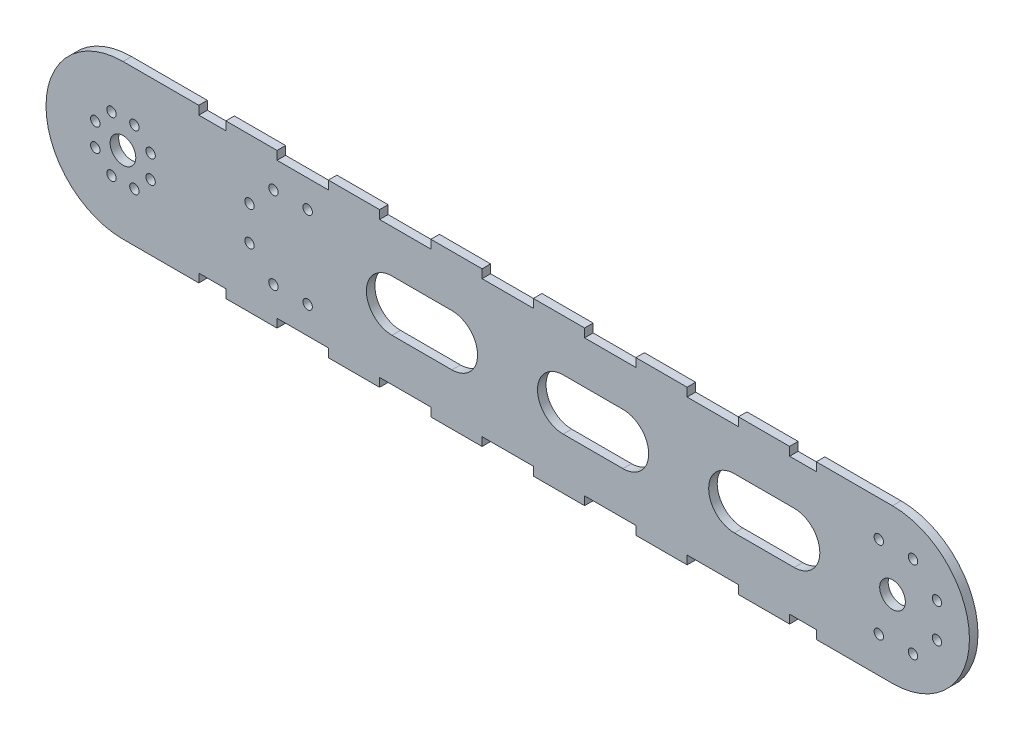
from build123d import *

# Parameters (mm, degrees)
SKETCH3_R           = 2.75
SKETCH3_R_2         = 7.5
BOSS_EXTRUDE1_DEPTH = 5
SKETCH3_3_W         = 15.822872328
SKETCH3_3_H         = 5
SKETCH3_3_W_2       = 30
SKETCH3_3_W_3       = 15.601661999
CUT_EXTRUDE1_DEPTH  = 292.043381646


with BuildPart() as part:
    # Sketch3 → Boss-Extrude1 (new body)
    with BuildSketch(Plane.XY):
        with BuildLine():
            ThreePointArc((-242.5, 45), (-287.5, 0), (-242.5, -45))
            Line((-242.5, -45), (207.5, -45))
            ThreePointArc((207.5, -45), (252.5, 0), (207.5, 45))
            Line((207.5, 45), (-242.5, 45))
        make_face()
        with Locations((-154.5, -24)):
            Circle(SKETCH3_R, mode=Mode.SUBTRACT)
        with Locations((-134.5, -24)):
            Circle(SKETCH3_R, mode=Mode.SUBTRACT)
        with Locations((-249.196960066, -16.167891819)):
            Circle(SKETCH3_R, mode=Mode.SUBTRACT)
        with Locations((-235.803039934, -16.167891819)):
            Circle(SKETCH3_R, mode=Mode.SUBTRACT)
        with Locations((-258.667891819, -6.696960066)):
            Circle(SKETCH3_R, mode=Mode.SUBTRACT)
        with Locations((-226.332108181, -6.696960066)):
            Circle(SKETCH3_R, mode=Mode.SUBTRACT)
        with Locations((-242.5, 0)):
            Circle(SKETCH3_R_2, mode=Mode.SUBTRACT)
        with Locations((-168.5, -10)):
            Circle(SKETCH3_R, mode=Mode.SUBTRACT)
        with BuildLine():
            ThreePointArc((-85.152, -15), (-100.152, 0), (-85.152, 15))
            Line((-85.152, 15), (-50.152, 15))
            ThreePointArc((-50.152, 15), (-35.152, 0), (-50.152, -15))
            Line((-50.152, -15), (-85.152, -15))
        make_face(mode=Mode.SUBTRACT)
        with Locations((199.5, -24)):
            Circle(SKETCH3_R, mode=Mode.SUBTRACT)
        with Locations((219.5, -24)):
            Circle(SKETCH3_R, mode=Mode.SUBTRACT)
        with BuildLine():
            ThreePointArc((14.924, -15), (-0.076, 0), (14.924, 15))
            Line((14.924, 15), (49.924, 15))
            ThreePointArc((49.924, 15), (64.924, 0), (49.924, -15))
            Line((49.924, -15), (14.924, -15))
        make_face(mode=Mode.SUBTRACT)
        with BuildLine():
            ThreePointArc((115, -15), (100, 0), (115, 15))
            Line((115, 15), (150, 15))
            ThreePointArc((150, 15), (165, 0), (150, -15))
            Line((150, -15), (115, -15))
        make_face(mode=Mode.SUBTRACT)
        with Locations((233.5, -10)):
            Circle(SKETCH3_R, mode=Mode.SUBTRACT)
        with Locations((207.5, 0)):
            Circle(SKETCH3_R_2, mode=Mode.SUBTRACT)
        with Locations((-258.667891819, 6.696960066)):
            Circle(SKETCH3_R, mode=Mode.SUBTRACT)
        with Locations((-226.332108181, 6.696960066)):
            Circle(SKETCH3_R, mode=Mode.SUBTRACT)
        with Locations((-168.5, 10)):
            Circle(SKETCH3_R, mode=Mode.SUBTRACT)
        with Locations((-249.196960066, 16.167891819)):
            Circle(SKETCH3_R, mode=Mode.SUBTRACT)
        with Locations((-235.803039934, 16.167891819)):
            Circle(SKETCH3_R, mode=Mode.SUBTRACT)
        with Locations((-154.5, 24)):
            Circle(SKETCH3_R, mode=Mode.SUBTRACT)
        with Locations((-134.5, 24)):
            Circle(SKETCH3_R, mode=Mode.SUBTRACT)
        with Locations((233.5, 10)):
            Circle(SKETCH3_R, mode=Mode.SUBTRACT)
        with Locations((199.5, 24)):
            Circle(SKETCH3_R, mode=Mode.SUBTRACT)
        with Locations((219.5, 24)):
            Circle(SKETCH3_R, mode=Mode.SUBTRACT)
    extrude(amount=BOSS_EXTRUDE1_DEPTH)

    # Sketch3<3> → Cut-Extrude1 (cut, through all)
    with BuildSketch(Plane.XY):
        with Locations((-190.243436164, 42.5)):
            Rectangle(SKETCH3_3_W, SKETCH3_3_H)
        with Locations((-137.388, 42.5)):
            Rectangle(SKETCH3_3_W_2, SKETCH3_3_H)
        with Locations((155.132831, 42.5)):
            Rectangle(SKETCH3_3_W_3, SKETCH3_3_H)
        with Locations((-77.444, 42.5)):
            Rectangle(SKETCH3_3_W_2, SKETCH3_3_H)
        with Locations((102.388, 42.5)):
            Rectangle(SKETCH3_3_W_2, SKETCH3_3_H)
        with Locations((-17.5, 42.5)):
            Rectangle(SKETCH3_3_W_2, SKETCH3_3_H)
        with Locations((42.444, 42.5)):
            Rectangle(SKETCH3_3_W_2, SKETCH3_3_H)
    cut_extrude1 = extrude(amount=CUT_EXTRUDE1_DEPTH, mode=Mode.SUBTRACT)

    # Mirror1: Cut-Extrude1 across plane
    add(cut_extrude1.mirror(Plane.ZX), mode=Mode.SUBTRACT)


solid = part.part
